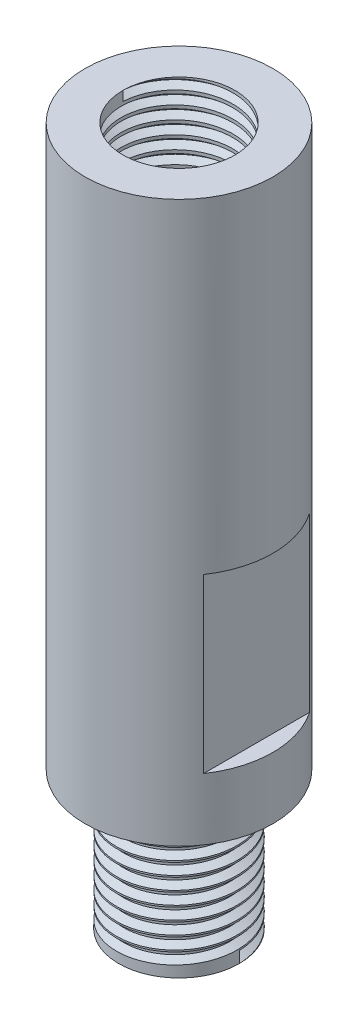
from build123d import *
from build123d.topology import SkipClean

# Parameters (mm, degrees)
SKETCH1_R               = 10.9
BOSS_EXTRUDE1_DEPTH     = 65
SKETCH2_R               = 6.5
CUT_EXTRUDE1_DEPTH      = 20
THREAD1_PITCH           = 1.5
SKETCH8_R               = 7
BOSS_EXTRUDE2_DEPTH     = 16
THREAD2_PITCH           = 1.5
CUT_EXTRUDE2_DEPTH      = 16
CUT_EXTRUDE2_DEPTH_BACK = 16
SKETCH23_W              = 1.9
SKETCH23_H              = 20


with BuildPart() as part:
    # Sketch1 → Boss-Extrude1 (new body)
    with BuildSketch(Plane(origin=(0, 0, 0), x_dir=(1, 0, 0), z_dir=(0, 1, 0))):
        with Locations(Location((0, 0, 0), (0, 0, 270))):
            Circle(SKETCH1_R)
    extrude(amount=BOSS_EXTRUDE1_DEPTH)

    # Sketch2 → Cut-Extrude1 (cut)
    with BuildSketch(Plane(origin=(0, 65, 0), x_dir=(1, 0, 0), z_dir=(0, 1, 0))):
        with Locations(Location((0, 0, 0), (0, 0, 270))):
            Circle(SKETCH2_R)
    extrude(amount=-CUT_EXTRUDE1_DEPTH, mode=Mode.SUBTRACT)

    # Thread1: the profile of Thread Profile1 profile screwed along a right-hand helix of 17.333333 turns, 8 arcs to a turn; built about Z, then put on its axis
    with SkipClean():  # the faces are left unmerged after this step: merging them gives an invalid solid
        thread1_z = Axis((0, 0, 0), (0, 0, 1))
        thread1_corners = [(6.4997, 0, -0.000173205), (7.311898813, 0, 0.468749998), (7.311898813, 0, 0.656249998), (6.4997, 0, 1.125173201)]
        with BuildLine(mode=Mode.PRIVATE) as thread1_profile:
            Line(thread1_corners[0], thread1_corners[1])
            Line(thread1_corners[1], thread1_corners[2])
            Line(thread1_corners[2], thread1_corners[3])
            Line(thread1_corners[3], thread1_corners[0])
        thread1_cap = Face(thread1_profile.wire())
        thread1_turn_angles = [0, 22.5, 45, 67.5, 90, 112.5, 135, 157.5, 180, 202.5, 225, 247.5, 270, 292.5, 315, 337.5, 360]
        thread1_turn_weights = [1, 0.9238795325112867, 1, 0.9238795325112867, 1, 0.9238795325112867, 1, 0.9238795325112867, 1, 0.9238795325112867, 1, 0.9238795325112867, 1, 0.9238795325112867, 1, 0.9238795325112867, 1]
        thread1_turn_rails = [Edge.make_bspline([Vector(p[0], p[1], 0).rotate(thread1_z, thread1_turn_angles[k]) / thread1_turn_weights[k] + Vector(0, 0, p[2] + THREAD1_PITCH * thread1_turn_angles[k] / 360) for k in range(17)], [0, 0, 0, 1, 1, 2, 2, 3, 3, 4, 4, 5, 5, 6, 6, 7, 7, 8, 8, 8], 2, thread1_turn_weights) for p in thread1_corners]
        thread1_turn_sides = [Face.make_surface_from_curves(thread1_turn_rails[p[0]], thread1_turn_rails[p[1]]) for p in [(0, 1), (1, 2), (2, 3), (3, 0)]]
        thread1_last_angles = [6120, 6142.5, 6165, 6187.5, 6210, 6225, 6240]
        thread1_last_weights = [1, 0.9238795325112867, 1, 0.9238795325112867, 1, 0.9659258262890683, 1]
        thread1_last_rails = [Edge.make_bspline([Vector(p[0], p[1], 0).rotate(thread1_z, thread1_last_angles[k]) / thread1_last_weights[k] + Vector(0, 0, p[2] + THREAD1_PITCH * thread1_last_angles[k] / 360) for k in range(7)], [0, 0, 0, 1, 1, 2, 2, 3, 3, 3], 2, thread1_last_weights) for p in thread1_corners]
        thread1_last_sides = [Face.make_surface_from_curves(thread1_last_rails[p[0]], thread1_last_rails[p[1]]) for p in [(0, 1), (1, 2), (2, 3), (3, 0)]]
        thread1 = Plane(origin=(0, 65, 0), x_dir=(-1, 0, 0), z_dir=(0, -1, 0)) * Solid(Shell([*[p.moved(Location((0, 0, THREAD1_PITCH * i))) for i in range(17) for p in thread1_turn_sides], *thread1_last_sides, thread1_cap, thread1_cap.rotate(thread1_z, 6240).moved(Location((0, 0, THREAD1_PITCH * 6240 / 360)))]))
        add(thread1, mode=Mode.SUBTRACT)

    # Sketch8 → Boss-Extrude2 (add)
    with SkipClean():  # the faces are left unmerged after this step: merging them gives an invalid solid
        with BuildSketch(Plane.XZ):
            with Locations(Location((0, 0, 0), (0, 0, 270))):
                Circle(SKETCH8_R)
        extrude(amount=BOSS_EXTRUDE2_DEPTH)

    # Thread2: the profile of Thread Profile2 profile screwed along a right-hand helix of 9.333333 turns, 8 arcs to a turn; built about Z, then put on its axis
    with SkipClean():  # the faces are left unmerged after this step: merging them gives an invalid solid
        thread2_z = Axis((0, 0, 0), (0, 0, 1))
        thread2_corners = [(7.0003, 0, -0.000173205), (7.0003, 0, 1.312673201), (6.188101188, 0, 0.843749998), (6.188101188, 0, 0.468749998)]
        with BuildLine(mode=Mode.PRIVATE) as thread2_profile:
            Line(thread2_corners[0], thread2_corners[1])
            Line(thread2_corners[1], thread2_corners[2])
            Line(thread2_corners[2], thread2_corners[3])
            Line(thread2_corners[3], thread2_corners[0])
        thread2_cap = Face(thread2_profile.wire())
        thread2_turn_angles = [0, 22.5, 45, 67.5, 90, 112.5, 135, 157.5, 180, 202.5, 225, 247.5, 270, 292.5, 315, 337.5, 360]
        thread2_turn_weights = [1, 0.9238795325112867, 1, 0.9238795325112867, 1, 0.9238795325112867, 1, 0.9238795325112867, 1, 0.9238795325112867, 1, 0.9238795325112867, 1, 0.9238795325112867, 1, 0.9238795325112867, 1]
        thread2_turn_rails = [Edge.make_bspline([Vector(p[0], p[1], 0).rotate(thread2_z, thread2_turn_angles[k]) / thread2_turn_weights[k] + Vector(0, 0, p[2] + THREAD2_PITCH * thread2_turn_angles[k] / 360) for k in range(17)], [0, 0, 0, 1, 1, 2, 2, 3, 3, 4, 4, 5, 5, 6, 6, 7, 7, 8, 8, 8], 2, thread2_turn_weights) for p in thread2_corners]
        thread2_turn_sides = [Face.make_surface_from_curves(thread2_turn_rails[p[0]], thread2_turn_rails[p[1]]) for p in [(0, 1), (1, 2), (2, 3), (3, 0)]]
        thread2_last_angles = [3240, 3262.5, 3285, 3307.5, 3330, 3345, 3360]
        thread2_last_weights = [1, 0.9238795325112867, 1, 0.9238795325112867, 1, 0.9659258262890693, 1]
        thread2_last_rails = [Edge.make_bspline([Vector(p[0], p[1], 0).rotate(thread2_z, thread2_last_angles[k]) / thread2_last_weights[k] + Vector(0, 0, p[2] + THREAD2_PITCH * thread2_last_angles[k] / 360) for k in range(7)], [0, 0, 0, 1, 1, 2, 2, 3, 3, 3], 2, thread2_last_weights) for p in thread2_corners]
        thread2_last_sides = [Face.make_surface_from_curves(thread2_last_rails[p[0]], thread2_last_rails[p[1]]) for p in [(0, 1), (1, 2), (2, 3), (3, 0)]]
        thread2 = Plane(origin=(0, -16, 0), x_dir=(1, 0, 0), z_dir=(0, 1, 0)) * Solid(Shell([*[p.moved(Location((0, 0, THREAD2_PITCH * i))) for i in range(9) for p in thread2_turn_sides], *thread2_last_sides, thread2_cap, thread2_cap.rotate(thread2_z, 3360).moved(Location((0, 0, THREAD2_PITCH * 3360 / 360)))]))
        add(thread2, mode=Mode.SUBTRACT)

    # Sketch23 → Cut-Extrude2 (cut, two sides: drawn at the far end of the back side and taken through both)
    with SkipClean():  # the faces are left unmerged after this step: merging them gives an invalid solid
        with BuildSketch(Plane.XY.offset(-CUT_EXTRUDE2_DEPTH_BACK)):
            with Locations((-9.95, 17)):
                Rectangle(SKETCH23_W, SKETCH23_H)
            with Locations((9.95, 17.174933336)):
                Rectangle(SKETCH23_W, SKETCH23_H)
        extrude(amount=CUT_EXTRUDE2_DEPTH + CUT_EXTRUDE2_DEPTH_BACK, mode=Mode.SUBTRACT)


solid = part.part
